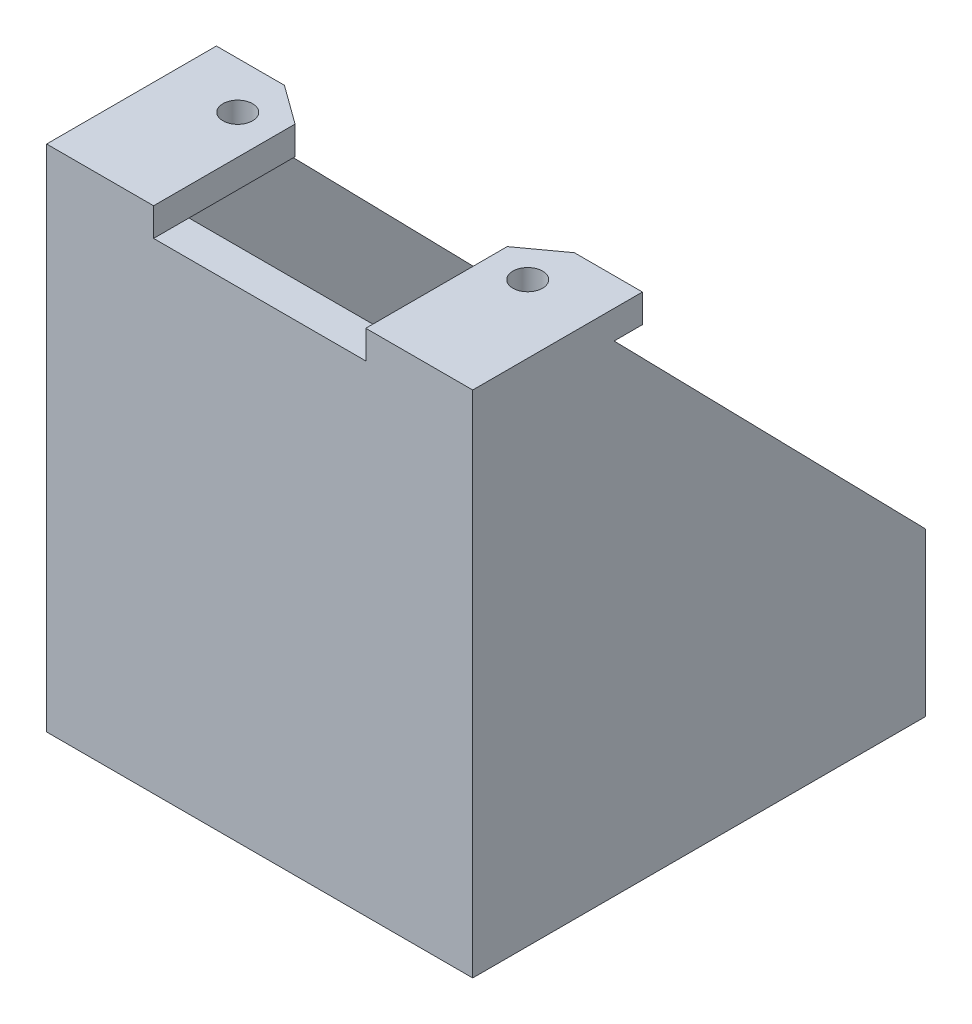
from build123d import *

# Parameters (mm, degrees)
BOSS_EXTRUDE1_DEPTH = 32.5
CUT_EXTRUDE1_DEPTH  = 55.658804268
SKETCH4_R           = 1.05
BOSS_EXTRUDE2_DEPTH = 1.5
SKETCH5_R           = 1.05
BOSS_EXTRUDE3_DEPTH = 2


with BuildPart() as part:
    # Sketch2 → Boss-Extrude1 (new body)
    with BuildSketch(Plane(origin=(0, 0, 0), x_dir=(1, 0, 0), z_dir=(0, 1, 0))):
        Polygon((15.061, 0), (15.061, 32), (12.561, 32), (12.561, 2.5), (-12.561, 2.5), (-12.561, 32), (-15.061, 32), (-15.061, 0), align=None)
    extrude(amount=BOSS_EXTRUDE1_DEPTH)

    # Sketch3 → Cut-Extrude1 (cut, through all)
    with BuildSketch(Plane(origin=(15.061, 0, 0), x_dir=(0, 0, -1), z_dir=(1, 0, 0))):
        Polygon((32, 10), (10, 32.5), (32, 32.5), align=None)
    extrude(amount=-CUT_EXTRUDE1_DEPTH, mode=Mode.SUBTRACT)

    # Sketch4 → Boss-Extrude2 (add)
    with BuildSketch(Plane.XZ):
        with BuildLine():
            Line((-15.061, 0), (-15.061, -32))
            Line((-15.061, -32), (-10.061, -32))
            ThreePointArc((-10.061, -32), (-7.939679656, -31.121320344), (-7.061, -29))
            Line((-7.061, -29), (-12.561, -20))
            Line((-12.561, -20), (-12.561, -10))
            Line((-12.561, -10), (-7.5, -6))
            Line((-7.5, -6), (7.5, -6))
            Line((7.5, -6), (12.561, -10))
            Line((12.561, -10), (12.561, -20))
            Line((12.561, -20), (7.061, -29))
            ThreePointArc((7.061, -29), (7.939679656, -31.121320344), (10.061, -32))
            Line((10.061, -32), (15.061, -32))
            Line((15.061, -32), (15.061, 0))
            Line((15.061, 0), (-15.061, 0))
        make_face()
        with Locations((-10.2499, -4.95)):
            Circle(SKETCH4_R, mode=Mode.SUBTRACT)
        with Locations((-10.2499, -29.4)):
            Circle(SKETCH4_R, mode=Mode.SUBTRACT)
        with Locations((10.2499, -29.4)):
            Circle(SKETCH4_R, mode=Mode.SUBTRACT)
        with Locations((10.2499, -4.95)):
            Circle(SKETCH4_R, mode=Mode.SUBTRACT)
    extrude(amount=BOSS_EXTRUDE2_DEPTH)

    # Sketch5 → Boss-Extrude3 (add)
    # profile 1 of 2: a face of its own
    with BuildSketch(Plane(origin=(0, 32.5, 0), x_dir=(1, 0, 0), z_dir=(0, 1, 0))):
        Polygon((-15.061, 12), (-10.2499, 12), (-7.5, 10), (-7.5, 0), (-15.061, 0), align=None)
        with Locations((-10.2499, 8.7)):
            Circle(SKETCH5_R, mode=Mode.SUBTRACT)
    # profile 2 of 2: a face of its own
    with BuildSketch(Plane(origin=(0, 32.5, 0), x_dir=(1, 0, 0), z_dir=(0, 1, 0))):
        Polygon((15.061, 12), (10.2499, 12), (7.5, 10), (7.5, 0), (15.061, 0), align=None)
        with Locations((10.2499, 8.7)):
            Circle(SKETCH5_R, mode=Mode.SUBTRACT)
    extrude(amount=BOSS_EXTRUDE3_DEPTH)


solid = part.part
